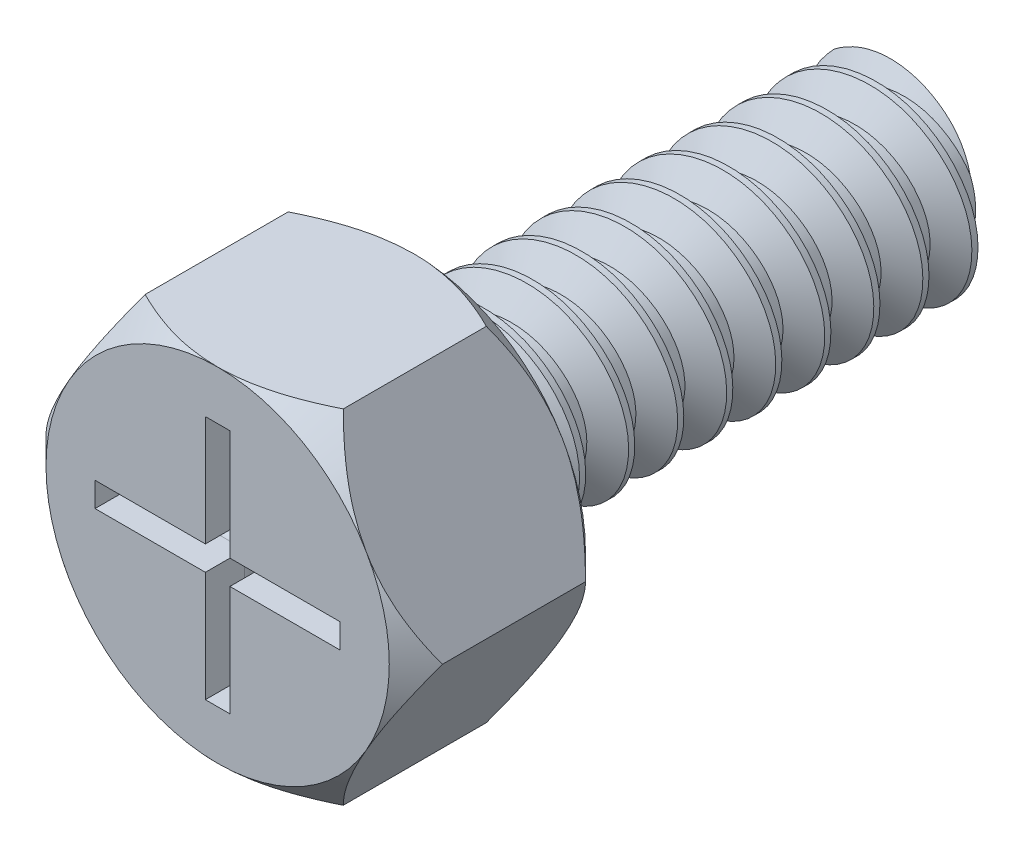
from build123d import *

# Parameters (mm, degrees)
BOSS_EXTRUDE1_DEPTH      = 2
BOSS_EXTRUDE2_DEPTH      = 2
BOSS_EXTRUDE2_DEPTH_BACK = 5
SKETCH1_3_R              = 1
THREAD1_PITCH            = 0.5
SKETCH1_8_OUTSIDE_W      = 9.804
SKETCH1_8_OUTSIDE_H      = 9.262
SKETCH1_8_OUTSIDE_R      = 1.75
CUT_EXTRUDE3_DEPTH       = 1
CUT_EXTRUDE3_DRAFT       = 45
SKETCH8_OUTSIDE_W        = 9.804
SKETCH8_OUTSIDE_H        = 9.262
SKETCH8_OUTSIDE_R        = 1.75
CUT_EXTRUDE4_DEPTH       = 1
CUT_EXTRUDE4_DRAFT       = -45
CUT_EXTRUDE5_DEPTH       = 0.5
FILLET1_R                = 0.1


with BuildPart() as part:
    # Sketch1 → Boss-Extrude1 (new body)
    with BuildSketch(Plane.XY):
        Polygon((2.020725942, 0), (1.010362971, 1.75), (-1.010362971, 1.75), (-2.020725942, 0), (-1.010362971, -1.75), (1.010362971, -1.75), align=None)
    extrude(amount=BOSS_EXTRUDE1_DEPTH)

    # Sketch1<3> → Boss-Extrude2 (add, two sides: drawn at the far end of the back side and taken through both)
    with BuildSketch(Plane.XY.offset(-BOSS_EXTRUDE2_DEPTH_BACK)):
        Circle(SKETCH1_3_R)
    extrude(amount=BOSS_EXTRUDE2_DEPTH + BOSS_EXTRUDE2_DEPTH_BACK)

    # Thread1: the profile of Thread Profile2 profile screwed along a right-hand helix of 10 turns, 6 arcs to a turn; built about Z, then put on its axis
    thread1_z = Axis((0, 0, 0), (0, 0, 1))
    thread1_corners = [(1.0003, 0, -0.000173205), (1.0003, 0, 0.437673204), (0.729367063, 0, 0.281249999), (0.729367062, 0, 0.156249999)]
    with BuildLine(mode=Mode.PRIVATE) as thread1_profile:
        Line(thread1_corners[0], thread1_corners[1])
        Line(thread1_corners[1], thread1_corners[2])
        Line(thread1_corners[2], thread1_corners[3])
        Line(thread1_corners[3], thread1_corners[0])
    thread1_cap = Face(thread1_profile.wire())
    thread1_turn_angles = [0, 30, 60, 90, 120, 150, 180, 210, 240, 270, 300, 330, 360]
    thread1_turn_weights = [1, 0.8660254037844387, 1, 0.8660254037844387, 1, 0.8660254037844387, 1, 0.8660254037844387, 1, 0.8660254037844387, 1, 0.8660254037844387, 1]
    thread1_turn_rails = [Edge.make_bspline([Vector(p[0], p[1], 0).rotate(thread1_z, thread1_turn_angles[k]) / thread1_turn_weights[k] + Vector(0, 0, p[2] + THREAD1_PITCH * thread1_turn_angles[k] / 360) for k in range(13)], [0, 0, 0, 1, 1, 2, 2, 3, 3, 4, 4, 5, 5, 6, 6, 6], 2, thread1_turn_weights) for p in thread1_corners]
    thread1_turn_sides = [Face.make_surface_from_curves(thread1_turn_rails[p[0]], thread1_turn_rails[p[1]]) for p in [(0, 1), (1, 2), (2, 3), (3, 0)]]
    thread1 = Plane(origin=(0, 0, 0), x_dir=(-1, 0, 0), z_dir=(0, 0, -1)) * Solid(Shell([*[p.moved(Location((0, 0, THREAD1_PITCH * i))) for i in range(10) for p in thread1_turn_sides], thread1_cap, thread1_cap.rotate(thread1_z, 3600).moved(Location((0, 0, THREAD1_PITCH * 3600 / 360)))]))
    add(thread1, mode=Mode.SUBTRACT)


with BuildPart() as cut_extrude3_tool:
    # Sketch1<8> outside → Cut-Extrude3 (with draft: the straight prism first)
    with BuildSketch(Plane.XY):
        Rectangle(SKETCH1_8_OUTSIDE_W, SKETCH1_8_OUTSIDE_H)
        Circle(SKETCH1_8_OUTSIDE_R, mode=Mode.SUBTRACT)
    extrude(amount=CUT_EXTRUDE3_DEPTH)
    # Cut-Extrude3: the draft: its side faces are tilted about the plane it starts from
    cut_extrude3_sides = [cut_extrude3_tool.faces().sort_by_distance(p)[0] for p in [
        (0, -4.631, 0.5),
        (4.902, 0, 0.5),
        (0, 4.631, 0.5),
        (-4.902, 0, 0.5),
        (-1.75, 0, 0.5),
    ]]
    draft(cut_extrude3_sides, Plane.XY, CUT_EXTRUDE3_DRAFT)


with BuildPart() as part_1:
    add(part.part)

    # Cut-Extrude3: cut by cut_extrude3_tool
    add(cut_extrude3_tool.part, mode=Mode.SUBTRACT)


with BuildPart() as cut_extrude4_tool:
    # Sketch8 outside → Cut-Extrude4 (with draft: the straight prism first)
    with BuildSketch(Plane.XY.offset(2)):
        Rectangle(SKETCH8_OUTSIDE_W, SKETCH8_OUTSIDE_H)
        Circle(SKETCH8_OUTSIDE_R, mode=Mode.SUBTRACT)
    extrude(amount=-CUT_EXTRUDE4_DEPTH)
    # Cut-Extrude4: the draft: its side faces are tilted about the plane it starts from
    cut_extrude4_sides = [cut_extrude4_tool.faces().sort_by_distance(p)[0] for p in [
        (0, -4.631, 1.5),
        (4.902, 0, 1.5),
        (0, 4.631, 1.5),
        (-4.902, 0, 1.5),
        (-1.75, 0, 1.5),
    ]]
    draft(cut_extrude4_sides, Plane.XY.offset(2), CUT_EXTRUDE4_DRAFT)


with BuildPart() as part_2:
    add(part_1.part)

    # Cut-Extrude4: cut by cut_extrude4_tool
    add(cut_extrude4_tool.part, mode=Mode.SUBTRACT)

    # Sketch10 → Cut-Extrude5 (cut)
    with BuildSketch(Plane.XY.offset(2)):
        Polygon((-0.125, -1.25), (0.125, -1.25), (0.125, -0.125), (1.25, -0.125), (1.25, 0.125), (0.125, 0.125), (0.125, 1.25), (-0.125, 1.25), (-0.125, 0.125), (-1.25, 0.125), (-1.25, -0.125), (-0.125, -0.125), align=None)
    extrude(amount=-CUT_EXTRUDE5_DEPTH, mode=Mode.SUBTRACT)

    # Fillet1
    fillet1_edges = [part_2.edges().sort_by_distance(p)[0] for p in [
        (-0.125, -0.6875, 1.5),
        (-0.6875, -0.125, 1.5),
        (-1.25, 0, 1.5),
        (-0.6875, 0.125, 1.5),
        (-0.125, 0.6875, 1.5),
        (0, 1.25, 1.5),
        (0.125, 0.6875, 1.5),
        (0.6875, 0.125, 1.5),
        (1.25, 0, 1.5),
        (0.6875, -0.125, 1.5),
        (0.125, -0.6875, 1.5),
        (0, -1.25, 1.5),
    ]]
    fillet(fillet1_edges, radius=FILLET1_R)


solid = part_2.part
